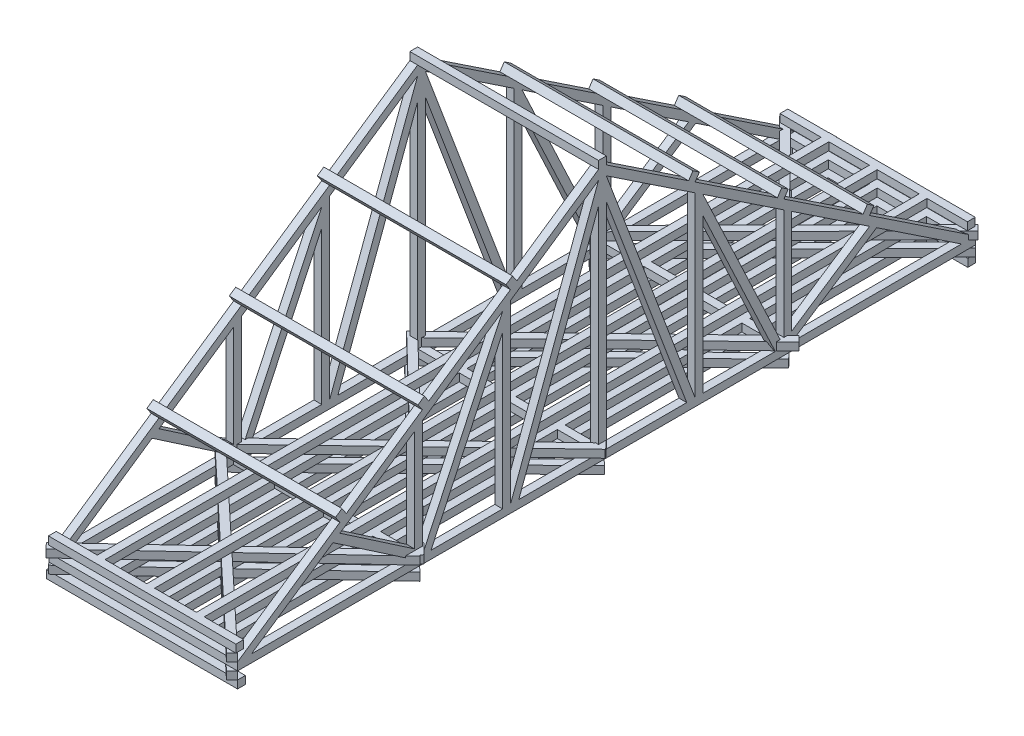
from build123d import *

# Parameters (mm, degrees)
SKETCH1_W               = 80
SKETCH1_H               = 300
SKETCH1_W_2             = 73.65
SKETCH1_H_2             = 293.65
SKETCH1_W_3             = 3.175
SKETCH1_H_3             = 3.175
EXTRUDE_THIN1_DEPTH     = 3.175
SKETCH2_W               = 3.175
SKETCH2_H               = 100
EXTRUDE_THIN8_DEPTH     = 3.175
EXTRUDE_THIN10_DEPTH    = 3.175
EXTRUDE_THIN11_DEPTH    = 3.175
SKETCH9_W               = 3.175
SKETCH9_H               = 48.092427745
EXTRUDE_THIN12_DEPTH    = 3.175
SKETCH11_W              = 3.175
SKETCH11_H              = 48.078885725
EXTRUDE_THIN13_DEPTH    = 3.175
SKETCH14_W              = 3.175
SKETCH14_H              = 71.754083222
EXTRUDE_THIN16_DEPTH    = 3.175
SKETCH15_W              = 3.175
SKETCH15_H              = 72.138641617
EXTRUDE_THIN17_DEPTH    = 3.175
EXTRUDE_THIN18_DEPTH    = 3.175
EXTRUDE_THIN20_DEPTH    = 3.175
EXTRUDE_THIN21_DEPTH    = 3.175
EXTRUDE_THIN22_DEPTH    = 3.175
EXTRUDE_THIN23_DEPTH    = 3.175
EXTRUDE_THIN24_DEPTH    = 3.175
CUT_EXTRUDE1_DEPTH      = 327.190128606
CUT_EXTRUDE1_DEPTH_BACK = 3.175
SKETCH23_W              = 76.701121679
SKETCH23_H              = 3.175
EXTRUDE_THIN25_DEPTH    = 3.175
SKETCH35_W              = 76.701121679
SKETCH35_H              = 3.175
EXTRUDE_THIN28_DEPTH    = 3.175
SKETCH34_W              = 76.701121679
SKETCH34_H              = 3.175
EXTRUDE_THIN30_DEPTH    = 3.175
EXTRUDE_THIN45_DEPTH    = 3.175
EXTRUDE_THIN46_DEPTH    = 3.175
EXTRUDE_THIN58_DEPTH    = 3.175
EXTRUDE_THIN58_2_DEPTH  = 3.175
EXTRUDE_THIN58_3_DEPTH  = 3.175
EXTRUDE_THIN58_4_DEPTH  = 3.175
EXTRUDE_THIN59_DEPTH    = 3.175
SKETCH62_W              = 76.179549979
SKETCH62_H              = 3.175
SKETCH62_W_2            = 3.175
SKETCH62_H_2            = 300.229366739
EXTRUDE_THIN63_DEPTH    = 3.175
SKETCH63_W              = 77.707565902
SKETCH63_H              = 3.175
SKETCH63_W_2            = 3.175
SKETCH63_H_2            = 300.060000052
SKETCH63_W_3            = 76.701121679
EXTRUDE_THIN64_DEPTH    = 3.175


with BuildPart() as part:
    # Sketch1 → Extrude-Thin1 (new body)
    # profile 1 of 7: a face of its own
    with BuildSketch(Plane(origin=(0, 0, 0), x_dir=(1, 0, 0), z_dir=(0, 1, 0))):
        with Locations((40, 150)):
            Rectangle(SKETCH1_W, SKETCH1_H)
        with Locations((40, 150)):
            Rectangle(SKETCH1_W_2, SKETCH1_H_2, mode=Mode.SUBTRACT)
    # profile 2 of 7: a face of its own
    with BuildSketch(Plane(origin=(0, 0, 0), x_dir=(1, 0, 0), z_dir=(0, 1, 0))):
        with Locations((41.5875, 150)):
            Rectangle(SKETCH1_W_3, SKETCH1_H)
    # profile 3 of 7: a face of its own
    with BuildSketch(Plane(origin=(0, 0, 0), x_dir=(1, 0, 0), z_dir=(0, 1, 0))):
        with Locations((61.5875, 150)):
            Rectangle(SKETCH1_W_3, SKETCH1_H)
    # profile 4 of 7: a face of its own
    with BuildSketch(Plane(origin=(0, 0, 0), x_dir=(1, 0, 0), z_dir=(0, 1, 0))):
        with Locations((21.5875, 150)):
            Rectangle(SKETCH1_W_3, SKETCH1_H)
    # profile 5 of 7: a face of its own
    with BuildSketch(Plane(origin=(0, 0, 0), x_dir=(1, 0, 0), z_dir=(0, 1, 0))):
        with Locations((40, 148.4125)):
            Rectangle(SKETCH1_W, SKETCH1_H_3)
    # profile 6 of 7: a face of its own
    with BuildSketch(Plane(origin=(0, 0, 0), x_dir=(1, 0, 0), z_dir=(0, 1, 0))):
        with Locations((40, 73.4125)):
            Rectangle(SKETCH1_W, SKETCH1_H_3)
    # profile 7 of 7: a face of its own
    with BuildSketch(Plane(origin=(0, 0, 0), x_dir=(1, 0, 0), z_dir=(0, 1, 0))):
        with Locations((40, 223.4125)):
            Rectangle(SKETCH1_W, SKETCH1_H_3)
    extrude(amount=EXTRUDE_THIN1_DEPTH)

    # Sketch2 → Extrude-Thin8 (add)
    with BuildSketch(Plane(origin=(80, 0, 0), x_dir=(0, 0, -1), z_dir=(1, 0, 0))):
        with Locations((148.31908478, 53.175)):
            Rectangle(SKETCH2_W, SKETCH2_H)
    extrude(amount=-EXTRUDE_THIN8_DEPTH)

    # Sketch4 → Extrude-Thin10 (add)
    with BuildSketch(Plane(origin=(80, 0, 0), x_dir=(0, 0, -1), z_dir=(1, 0, 0))):
        Polygon((0, 3.175), (146.73158478, 103.175), (148.519638887, 100.551359873), (1.788054106, 0.551359873), align=None)
    extrude(amount=-EXTRUDE_THIN10_DEPTH)

    # Sketch6 → Extrude-Thin11 (add)
    with BuildSketch(Plane(origin=(80, 0, 0), x_dir=(0, 0, -1), z_dir=(1, 0, 0))):
        Polygon((149.90658478, 103.175), (300, 3.175), (298.239585947, 0.532734426), (148.146170728, 100.532734426), align=None)
    extrude(amount=-EXTRUDE_THIN11_DEPTH)

    # Sketch9 → Extrude-Thin12 (add)
    with BuildSketch(Plane(origin=(80, 0, 0), x_dir=(0, 0, -1), z_dir=(1, 0, 0))):
        with Locations((223.677652044, 27.221213873)):
            Rectangle(SKETCH9_W, SKETCH9_H)
    extrude(amount=-EXTRUDE_THIN12_DEPTH)

    # Sketch11 → Extrude-Thin13 (add)
    with BuildSketch(Plane(origin=(80, 0, 0), x_dir=(0, 0, -1), z_dir=(1, 0, 0))):
        with Locations((73.528247819, 27.214442863)):
            Rectangle(SKETCH11_W, SKETCH11_H)
    extrude(amount=-EXTRUDE_THIN13_DEPTH)

    # Sketch14 → Extrude-Thin16 (add)
    with BuildSketch(Plane(origin=(80, 0, 0), x_dir=(0, 0, -1), z_dir=(1, 0, 0))):
        with Locations((109.3361663, 39.052041611)):
            Rectangle(SKETCH14_W, SKETCH14_H)
    extrude(amount=-EXTRUDE_THIN16_DEPTH)

    # Sketch15 → Extrude-Thin17 (add)
    with BuildSketch(Plane(origin=(80, 0, 0), x_dir=(0, 0, -1), z_dir=(1, 0, 0))):
        with Locations((187.585868412, 39.244320808)):
            Rectangle(SKETCH15_W, SKETCH15_H)
    extrude(amount=-EXTRUDE_THIN17_DEPTH)

    # Sketch16 → Extrude-Thin18 (add)
    with BuildSketch(Plane(origin=(80, 0, 0), x_dir=(0, 0, -1), z_dir=(1, 0, 0))):
        Polygon((110.9236663, 3.175), (146.73158478, 99.33277145), (149.706978026, 98.224773238), (113.899059545, 2.067001789), align=None)
    extrude(amount=-EXTRUDE_THIN18_DEPTH)

    # Sketch17 → Extrude-Thin20 (add)
    with BuildSketch(Plane(origin=(80, 0, 0), x_dir=(0, 0, -1), z_dir=(1, 0, 0))):
        Polygon((185.998368412, 3.175), (149.90658478, 99.359855489), (146.93396794, 98.244429955), (183.025751572, 2.059574466), align=None)
    extrude(amount=-EXTRUDE_THIN20_DEPTH)

    # Sketch18 → Extrude-Thin21 (add)
    with BuildSketch(Plane(origin=(80, 0, 0), x_dir=(0, 0, -1), z_dir=(1, 0, 0))):
        Polygon((75.115747819, 3.175), (107.7486663, 72.76526825), (110.623300267, 71.417268045), (77.990381786, 1.826999794), align=None)
    extrude(amount=-EXTRUDE_THIN21_DEPTH)

    # Sketch19 → Extrude-Thin22 (add)
    with BuildSketch(Plane(origin=(80, 0, 0), x_dir=(0, 0, -1), z_dir=(1, 0, 0))):
        Polygon((222.090152044, 3.175), (189.173368412, 73.198292322), (186.300010359, 71.847574551), (219.216793991, 1.824282229), align=None)
    extrude(amount=-EXTRUDE_THIN22_DEPTH)

    # Sketch20 → Extrude-Thin23 (add)
    with BuildSketch(Plane(origin=(80, 0, 0), x_dir=(0, 0, -1), z_dir=(1, 0, 0))):
        Polygon((71.940747819, 3.175), (38.789255331, 25.768290012), (40.577309437, 28.391930138), (73.728801925, 5.798640127), align=None)
    extrude(amount=-EXTRUDE_THIN23_DEPTH)

    # Sketch21 → Extrude-Thin24 (add)
    with BuildSketch(Plane(origin=(80, 0, 0), x_dir=(0, 0, -1), z_dir=(1, 0, 0))):
        Polygon((225.265152044, 3.175), (259.769435676, 26.163539225), (258.009021624, 28.805804799), (223.504737992, 5.817265574), align=None)
    extrude(amount=-EXTRUDE_THIN24_DEPTH)

    # Sketch22 → Cut-Extrude1 (cut, two sides: drawn at the far end of the back side and taken through both)
    with BuildSketch(Plane(origin=(0, 3.175, 0), x_dir=(1, 0, 0), z_dir=(0, 1, 0)).offset(-CUT_EXTRUDE1_DEPTH_BACK)):
        Polygon((41.64943916, 915.754655888), (41.64943916, 300), (41.64943916, 0), (41.64943916, -615.754655888), (-1189.859872615, -615.754655888), (-1189.859872615, 915.754655888), align=None)
    extrude(amount=CUT_EXTRUDE1_DEPTH + CUT_EXTRUDE1_DEPTH_BACK, mode=Mode.SUBTRACT)

    # Mirror12: part across plane


with BuildPart() as part_1:
    add(part.part)
    add(part.part.mirror(Plane(origin=(41.64943916, 443.266945807, -300), x_dir=(0, 0, 1), z_dir=(1, 0, 0))))

    # Sketch23 → Extrude-Thin25 (add)
    with BuildSketch(Plane(origin=(0, 103.175, 0), x_dir=(1, 0, 0), z_dir=(0, 1, 0))):
        with Locations((41.649439161, 148.31908478)):
            Rectangle(SKETCH23_W, SKETCH23_H)
    extrude(amount=EXTRUDE_THIN25_DEPTH)

    # Sketch35 → Extrude-Thin28 (add)
    with BuildSketch(Plane(origin=(0, 2.168027563, 1.477546615), x_dir=(1, 0, 0), z_dir=(0, 0.826343346951808, 0.5631666475817652))):
        with Locations((41.649439161, 137.609909243)):
            Rectangle(SKETCH35_W, SKETCH35_H)
        with Locations((41.649439161, 94.27693075)):
            Rectangle(SKETCH35_W, SKETCH35_H)
        with Locations((41.649439161, 53.727670942)):
            Rectangle(SKETCH35_W, SKETCH35_H)
    extrude(amount=EXTRUDE_THIN28_DEPTH)

    # Sketch34 → Extrude-Thin30 (add)
    with BuildSketch(Plane(origin=(0, 140.627283586, -93.693173268), x_dir=(1, 0, 0), z_dir=(0, 0.8322096295572368, -0.5544611189905083))):
        with Locations((41.649439161, 152.696918512)):
            Rectangle(SKETCH34_W, SKETCH34_H)
        with Locations((41.649439161, 194.532703691)):
            Rectangle(SKETCH34_W, SKETCH34_H)
        with Locations((41.649439161, 109.328297974)):
            Rectangle(SKETCH34_W, SKETCH34_H)
    extrude(amount=EXTRUDE_THIN30_DEPTH)

    # Sketch37 → Extrude-Thin45 (add)
    with BuildSketch(Plane.XZ):
        Polygon((81.133163278, -298.888200902), (5.545728977, -221.848288745), (82.270667627, -146.825), (4.408752888, -70.689951677), (2.189003754, -72.960048323), (77.729332373, -146.825), (1.052027665, -221.801711255), (78.866836722, -301.111799098), align=None)
        Polygon((4.432041599, -301.111799098), (82.246850656, -221.801711255), (5.569545948, -146.825), (82.296034217, -71.800196005), (4.383972934, 1.158760515), (2.213783708, -1.158760515), (77.703965783, -71.849803995), (1.028210693, -146.825), (77.753149344, -221.848288745), (2.165715042, -298.888200902), align=None)
    extrude(amount=EXTRUDE_THIN45_DEPTH)

    # Sketch38 → Extrude-Thin46 (add)
    with BuildSketch(Plane(origin=(0, 0, 0), x_dir=(-1, 0, 0), z_dir=(0, -1, 0))):
        Polygon((-80, 0), (-3.853815604, 71.257475839), (-1.684402922, 68.939227877), (-77.830587318, -2.318247962), align=None)
    extrude(amount=EXTRUDE_THIN46_DEPTH)



with BuildPart() as body_2:
    # Sketch39 → Extrude-Thin58 (new body)
    with BuildSketch(Plane(origin=(0, 3.175, 0), x_dir=(1, 0, 0), z_dir=(0, 1, 0))):
        Polygon((3.298878321, 301.594019777), (81.615585178, 221.964792417), (79.351942968, 219.738461592), (1.03523611, 299.367688952), align=None)
    extrude(amount=EXTRUDE_THIN58_DEPTH)


with BuildPart() as body_3:
    # Sketch39 → Extrude-Thin58 2 (new body)
    with BuildSketch(Plane(origin=(0, 3.175, 0), x_dir=(1, 0, 0), z_dir=(0, 1, 0))):
        Polygon((3.298878321, 71.940747819), (80, 0), (77.827949525, -2.315776702), (1.126827846, 69.624971116), align=None)
    extrude(amount=EXTRUDE_THIN58_2_DEPTH)


with BuildPart() as body_4:
    # Sketch39 → Extrude-Thin58 3 (new body)
    with BuildSketch(Plane(origin=(0, 3.175, 0), x_dir=(1, 0, 0), z_dir=(0, 1, 0))):
        Polygon((3.298878321, 149.90658478), (83.369121387, 72.500486923), (81.162354563, 70.217768108), (1.092111497, 147.623865966), align=None)
    extrude(amount=EXTRUDE_THIN58_3_DEPTH)


with BuildPart() as body_5:
    # Sketch39 → Extrude-Thin58 4 (new body)
    with BuildSketch(Plane(origin=(0, 3.175, 0), x_dir=(1, 0, 0), z_dir=(0, 1, 0))):
        Polygon((2.374736079, 225.265152044), (82.738297713, 147.084306475), (80.524351779, 144.808549808), (0.160790146, 222.989395378), align=None)
    extrude(amount=EXTRUDE_THIN58_4_DEPTH)


with BuildPart() as part_2:
    add(part_1.part)

    add(body_2.part)  # Extrude-Thin59 merges body 2

    add(body_3.part)  # Extrude-Thin59 merges body 3

    add(body_4.part)  # Extrude-Thin59 merges body 4

    add(body_5.part)  # Extrude-Thin59 merges body 5
    # Sketch41 → Extrude-Thin59 (add)
    with BuildSketch(Plane(origin=(0, 3.175, 0), x_dir=(1, 0, 0), z_dir=(0, 1, 0))):
        Polygon((1.092111497, 147.623865966), (82.482981178, 225.841551244), (84.682976258, 223.552305375), (3.292106578, 145.334620097), align=None)
        Polygon((1.092111497, 222.083369198), (79.691577834, 301.278344432), (81.945098583, 299.041769097), (3.345632247, 219.846793863), align=None)
        Polygon((0, 71.544493698), (80.853606069, 148.71332141), (83.045723654, 146.416531152), (2.192117586, 69.24770344), align=None)
        Polygon((2.292434098, 0), (80.853606069, 73.459717205), (83.022110514, 71.140619649), (4.460938543, -2.319097556), align=None)
    extrude(amount=EXTRUDE_THIN59_DEPTH)

    # Sketch62 → Extrude-Thin63 (add)
    with BuildSketch(Plane(origin=(0, 6.35, 0), x_dir=(1, 0, 0), z_dir=(0, 1, 0))):
        with Locations((41.637921211, 1.174171096)):
            Rectangle(SKETCH62_W, SKETCH62_H)
        with Locations((41.637921211, 298.54014537)):
            Rectangle(SKETCH62_W, SKETCH62_H)
        Polygon((39.890406877, 299.975384335), (40.361826986, -0.002494779), (43.536823066, 0.002494779), (43.065402957, 299.980373893), align=None)
        Polygon((60.124003162, 299.507706678), (60.523493546, -0.002117428), (63.698490722, 0.002117428), (63.299000338, 299.511941533), align=None)
        with Locations((21.822481066, 150.114683369)):
            Rectangle(SKETCH62_W_2, SKETCH62_H_2)
    extrude(amount=EXTRUDE_THIN63_DEPTH)

    # Sketch63 → Extrude-Thin64 (add)
    with BuildSketch(Plane.XZ.offset(3.175)):
        with Locations((41.146217049, -1.5875)):
            Rectangle(SKETCH63_W, SKETCH63_H)
        with Locations((21.634087737, -150.030000026)):
            Rectangle(SKETCH63_W_2, SKETCH63_H_2)
        with Locations((41.442331254, -150.030000026)):
            Rectangle(SKETCH63_W_2, SKETCH63_H_2)
        with Locations((61.557679597, -150.030000026)):
            Rectangle(SKETCH63_W_2, SKETCH63_H_2)
        with Locations((41.649439161, -298.4125)):
            Rectangle(SKETCH63_W_3, SKETCH63_H)
    extrude(amount=EXTRUDE_THIN64_DEPTH)


solid = part_2.part
